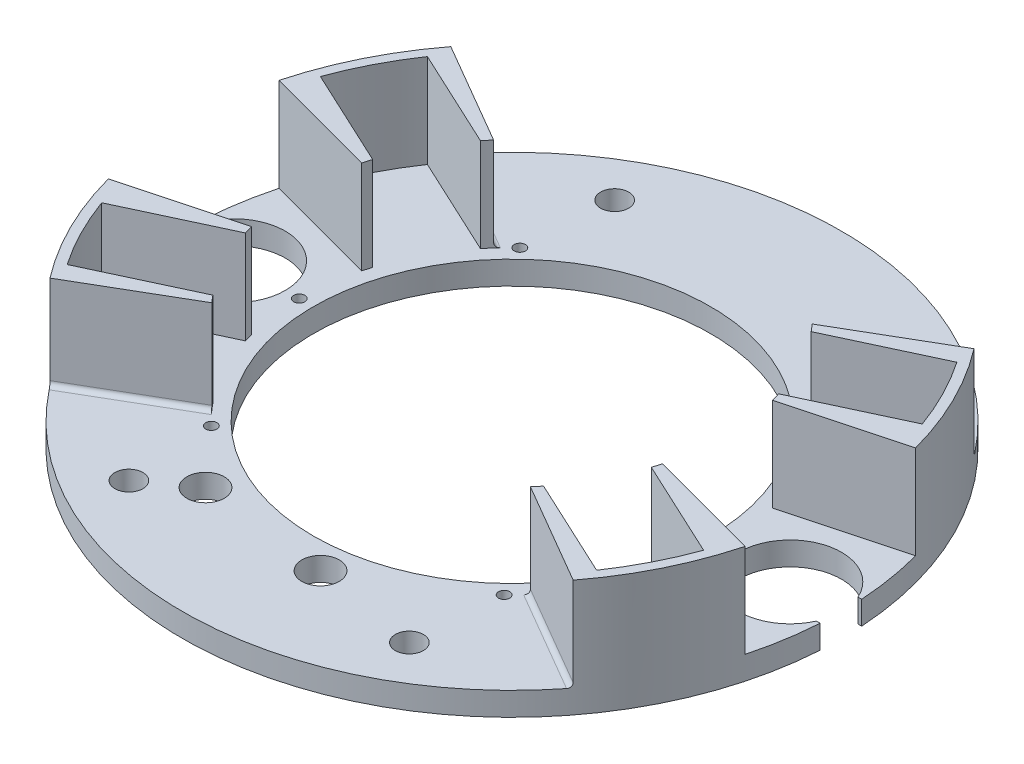
from build123d import *
from build123d.topology import SkipClean

# Parameters (mm, degrees)
SKETCH1_R                     = 89.535
SKETCH1_R_2                   = 53.975
BASE_DEPTH                    = 6.35
NOCE_START                    = -6.35
NOCE_CONE_PYROS_DEPTH         = 6.35
BATTERY_1_HOLDER_DEPTH        = 25.4
BATTERY_4_HOLDER_COPY_1_DEPTH = 25.4
BATTERY_4_HOLDER_COPY_2_DEPTH = 25.4
SKETCH4_R                     = 3.81
BOLT_HOLE_DEPTH               = 6.35
BOLT_HOLE_4_COPY_1_SKETCH_R   = 3.81
BOLT_HOLE_4_COPY_1_DEPTH      = 6.35
BOLT_HOLE_4_COPY_2_SKETCH_R   = 3.81
BOLT_HOLE_4_COPY_2_DEPTH      = 6.35
SKETCH11_R                    = 5.08
CUT_EXTRUDE2_DEPTH            = 6.35
SKETCH13_R                    = 3.175
CUT_EXTRUDE3_DEPTH            = 3.175
SKETCH14_R                    = 1.524
CUT_EXTRUDE4_DEPTH            = 3.175
FILLET3_R                     = 1.27
SKETCH15_R                    = 1.524
CUT_EXTRUDE5_DEPTH            = 6.35


with BuildPart() as part:
    # Sketch1 → Base (new body)
    with BuildSketch(Plane(origin=(0, 0, 0), x_dir=(1, 0, 0), z_dir=(0, 1, 0))):
        with Locations(Location((0, 0, 0), (0, 0, 270))):
            Circle(SKETCH1_R)
        with Locations(Location((0, 0, 0), (0, 0, 270))):
            Circle(SKETCH1_R_2, mode=Mode.SUBTRACT)
    extrude(amount=BASE_DEPTH)

    # Sketch2 → Noce Cone Pyros (cut)
    with BuildSketch(Plane(origin=(0, 6.35, 0), x_dir=(1, 0, 0), z_dir=(0, 1, 0)).offset(NOCE_START)):
        with BuildLine():
            Line((89.3564, 5.652439), (88.3404, 5.652439))
            ThreePointArc((88.3404, 5.652439), (61.595, 0), (88.3404, -5.652439))
            Line((88.3404, -5.652439), (89.3564, -5.652439))
            ThreePointArc((89.3564, -5.652439), (89.490339, -2.82763), (89.535, 0))
            ThreePointArc((89.535, 0), (89.490339, 2.82763), (89.3564, 5.652439))
        make_face()
    noce_cone_pyros = extrude(amount=NOCE_CONE_PYROS_DEPTH, mode=Mode.SUBTRACT)

    # Nose Cone Pyro mirror: Noce Cone Pyros across plane
    add(noce_cone_pyros.mirror(Plane(origin=(0, 0, 0), x_dir=(0, 0, 1), z_dir=(1, 0, 0))), mode=Mode.SUBTRACT)

    # Sketch3 → Battery 1 Holder (add)
    with BuildSketch(Plane(origin=(0, 6.35, 0), x_dir=(1, 0, 0), z_dir=(0, 1, 0))):
        with BuildLine():
            ThreePointArc((55.138033, 17.288828), (55.489291, 16.125907), (55.816024, 14.955859))
            Line((55.816024, 14.955859), (86.484169, 23.173363))
            ThreePointArc((86.484169, 23.173363), (80.316454, 39.569982), (71.074049, 54.451775))
            Line((71.074049, 54.451775), (43.281478, 38.286027))
            ThreePointArc((43.281478, 38.286027), (44.112475, 37.325538), (44.922161, 36.347018))
            Line((44.922161, 36.347018), (71.924647, 48.938484))
            ThreePointArc((71.924647, 48.938484), (77.444747, 39.628792), (81.766133, 29.705715))
            Line((81.766133, 29.705715), (55.138033, 17.288828))
        make_face()
    battery_1_holder = extrude(amount=BATTERY_1_HOLDER_DEPTH)

    # Batery 2 Holder: Battery 1 Holder across plane
    add(battery_1_holder.mirror(Plane.XY))

    # Battery 3 Holder: Battery 1 Holder across plane
    with SkipClean():  # the faces are left unmerged after this step: merging them gives an invalid solid
        add(battery_1_holder.mirror(Plane(origin=(0, 0, 0), x_dir=(0, 0, 1), z_dir=(1, 0, 0))))

    # Battery 4 Holder copy 1 sketch → Battery 4 Holder copy 1 (add)
    with SkipClean():  # the faces are left unmerged after this step: merging them gives an invalid solid
        with BuildSketch(Plane(origin=(0, 6.35, 0), x_dir=(-1, 0, 0), z_dir=(0, 1, 0))):
            with BuildLine():
                ThreePointArc((55.138033, 17.288828), (55.489291, 16.125907), (55.816024, 14.955859))
                Line((55.816024, 14.955859), (86.484169, 23.173363))
                ThreePointArc((86.484169, 23.173363), (80.316454, 39.569982), (71.074049, 54.451775))
                Line((71.074049, 54.451775), (43.281478, 38.286027))
                ThreePointArc((43.281478, 38.286027), (44.112475, 37.325538), (44.922161, 36.347018))
                Line((44.922161, 36.347018), (71.924647, 48.938484))
                ThreePointArc((71.924647, 48.938484), (77.444747, 39.628792), (81.766133, 29.705715))
                Line((81.766133, 29.705715), (55.138033, 17.288828))
            make_face()
        extrude(amount=BATTERY_4_HOLDER_COPY_1_DEPTH)

    # Battery 4 Holder copy 2 sketch → Battery 4 Holder copy 2 (add)
    with SkipClean():  # the faces are left unmerged after this step: merging them gives an invalid solid
        with BuildSketch(Plane(origin=(0, 6.35, 0), x_dir=(-1, 0, 0), z_dir=(0, 1, 0))):
            with BuildLine():
                ThreePointArc((55.138033, -17.288828), (55.489291, -16.125907), (55.816024, -14.955859))
                Line((55.816024, -14.955859), (86.484169, -23.173363))
                ThreePointArc((86.484169, -23.173363), (80.316454, -39.569982), (71.074049, -54.451775))
                Line((71.074049, -54.451775), (43.281478, -38.286027))
                ThreePointArc((43.281478, -38.286027), (44.112475, -37.325538), (44.922161, -36.347018))
                Line((44.922161, -36.347018), (71.924647, -48.938484))
                ThreePointArc((71.924647, -48.938484), (77.444747, -39.628792), (81.766133, -29.705715))
                Line((81.766133, -29.705715), (55.138033, -17.288828))
            make_face()
        extrude(amount=BATTERY_4_HOLDER_COPY_2_DEPTH)

    # Sketch4 → Bolt Hole (cut)
    with SkipClean():  # the faces are left unmerged after this step: merging them gives an invalid solid
        with BuildSketch(Plane(origin=(0, 6.35, 0), x_dir=(1, 0, 0), z_dir=(0, 1, 0))):
            with Locations(Location((38.1, 65.991136, 0), (0, 0, 270))):
                Circle(SKETCH4_R)
        bolt_hole = extrude(amount=-BOLT_HOLE_DEPTH, mode=Mode.SUBTRACT)

    # Bolt Hole 2: Bolt Hole across plane
    with SkipClean():  # the faces are left unmerged after this step: merging them gives an invalid solid
        add(bolt_hole.mirror(Plane.XY), mode=Mode.SUBTRACT)

    # Bolt Hole 3: Bolt Hole across plane
    with SkipClean():  # the faces are left unmerged after this step: merging them gives an invalid solid
        add(bolt_hole.mirror(Plane(origin=(0, 0, 0), x_dir=(0, 0, 1), z_dir=(1, 0, 0))), mode=Mode.SUBTRACT)

    # Bolt Hole 4 copy 1 sketch → Bolt Hole 4 copy 1 (cut)
    with SkipClean():  # the faces are left unmerged after this step: merging them gives an invalid solid
        with BuildSketch(Plane(origin=(0, 6.35, 0), x_dir=(-1, 0, 0), z_dir=(0, 1, 0))):
            with Locations(Location((38.1, 65.991136, 0), (0, 0, 270))):
                Circle(BOLT_HOLE_4_COPY_1_SKETCH_R)
        extrude(amount=-BOLT_HOLE_4_COPY_1_DEPTH, mode=Mode.SUBTRACT)

    # Bolt Hole 4 copy 2 sketch → Bolt Hole 4 copy 2 (cut)
    with SkipClean():  # the faces are left unmerged after this step: merging them gives an invalid solid
        with BuildSketch(Plane(origin=(0, 6.35, 0), x_dir=(-1, 0, 0), z_dir=(0, 1, 0))):
            with Locations((38.1, -65.991136)):
                Circle(BOLT_HOLE_4_COPY_2_SKETCH_R)
        extrude(amount=-BOLT_HOLE_4_COPY_2_DEPTH, mode=Mode.SUBTRACT)

    # Sketch11 → Cut-Extrude2 (cut)
    with SkipClean():  # the faces are left unmerged after this step: merging them gives an invalid solid
        with BuildSketch(Plane.XZ):
            with Locations(Location((9.128366, 61.145977, 0), (0, 0, 270))):
                Circle(SKETCH11_R)
            with Locations(Location((-26.059706, 57.209264, 0), (0, 0, 270))):
                Circle(SKETCH11_R)
        extrude(amount=-CUT_EXTRUDE2_DEPTH, mode=Mode.SUBTRACT)

    # Sketch13 → Cut-Extrude3 (cut)
    with SkipClean():  # the faces are left unmerged after this step: merging them gives an invalid solid
        with BuildSketch(Plane.XZ):
            with Locations(Location((39.7764, 41.91, 0), (0, 0, 270))):
                Circle(SKETCH13_R)
            with Locations(Location((-39.7764, 41.91, 0), (0, 0, 270))):
                Circle(SKETCH13_R)
        cut_extrude3 = extrude(amount=-CUT_EXTRUDE3_DEPTH, mode=Mode.SUBTRACT)

    # Sketch14 → Cut-Extrude4 (cut)
    with SkipClean():  # the faces are left unmerged after this step: merging them gives an invalid solid
        with BuildSketch(Plane.XZ.offset(-3.175)):
            with Locations(Location((39.7764, 41.91, 0), (0, 0, 270))):
                Circle(SKETCH14_R)
            with Locations(Location((-39.7764, 41.91, 0), (0, 0, 270))):
                Circle(SKETCH14_R)
        cut_extrude4 = extrude(amount=-CUT_EXTRUDE4_DEPTH, mode=Mode.SUBTRACT)

    # Mirror1: Cut-Extrude3, Cut-Extrude4 across plane
    with SkipClean():  # the faces are left unmerged after this step: merging them gives an invalid solid
        add(cut_extrude3.mirror(Plane.XY), mode=Mode.SUBTRACT)
        add(cut_extrude4.mirror(Plane.XY), mode=Mode.SUBTRACT)

    # Fillet3
    # the kernel refuses this fillet: 1.27 mm, written as the material it adds along each edge
    with BuildSketch(Plane(origin=(-73.818547, 6.35, 56.048132), x_dir=(0.5027895932474892, 0, 0.8644088297339543), z_dir=(0.8644088297339544, 0, -0.5027895932474892))) as fillet3_piece_1_section:
        with BuildLine():
            CenterArc((FILLET3_R, -FILLET3_R), FILLET3_R, 90, 90)
            Line((0, -FILLET3_R), (0, 0))
            Line((0, 0), (FILLET3_R, 0))
        make_face()
    fillet3_piece_1 = extrude(amount=38.502113, mode=Mode.PRIVATE)
    fillet3_piece_1 = fillet3_piece_1 & Plane(origin=(0, 6.637419, 0), x_dir=(0, 0, 1), z_dir=(0, -1, 0)) * Cylinder(89.535, 83, mode=Mode.PRIVATE)
    fillet3_piece_1 = fillet3_piece_1 - Plane(origin=(0, 6.637419, 0), x_dir=(-0.7490088761778874, 0, 0.6625599621217225), z_dir=(0, -1, 0)) * Cylinder(57.785, 83, mode=Mode.PRIVATE)
    add(fillet3_piece_1)
    with BuildSketch(Plane(origin=(73.818547, 6.35, -56.048132), x_dir=(-0.5027895932474892, 0, -0.8644088297339543), z_dir=(-0.8644088297339544, 0, 0.5027895932474892))) as fillet3_piece_2_section:
        with BuildLine():
            CenterArc((FILLET3_R, -FILLET3_R), FILLET3_R, 90, 90)
            Line((0, -FILLET3_R), (0, 0))
            Line((0, 0), (FILLET3_R, 0))
        make_face()
    fillet3_piece_2 = extrude(amount=38.502113, mode=Mode.PRIVATE)
    fillet3_piece_2 = fillet3_piece_2 - Plane(origin=(0, 6.637419, 0), x_dir=(0.7490088761778874, 0, -0.6625599621217225), z_dir=(0, -1, 0)) * Cylinder(57.785, 83, mode=Mode.PRIVATE)
    fillet3_piece_2 = fillet3_piece_2 & Plane(origin=(0, 6.637419, 0), x_dir=(0, 0, 1), z_dir=(0, -1, 0)) * Cylinder(89.535, 83, mode=Mode.PRIVATE)
    add(fillet3_piece_2)
    with BuildSketch(Plane(origin=(73.818547, 6.35, 56.048132), x_dir=(-0.5027895932474892, 0, 0.8644088297339543), z_dir=(-0.8644088297339544, 0, -0.5027895932474892))) as fillet3_piece_3_section:
        with BuildLine():
            CenterArc((FILLET3_R, FILLET3_R), FILLET3_R, 180, 90)
            Line((0, FILLET3_R), (0, 0))
            Line((0, 0), (FILLET3_R, 0))
        make_face()
    fillet3_piece_3 = extrude(amount=38.502113, mode=Mode.PRIVATE)
    fillet3_piece_3 = fillet3_piece_3 & Plane(origin=(0, 6.637418, 0), x_dir=(0, 0, 1), z_dir=(0, -1, 0)) * Cylinder(89.535, 83, mode=Mode.PRIVATE)
    fillet3_piece_3 = fillet3_piece_3 - Plane(origin=(0, 6.637418, 0), x_dir=(0.7490088761778874, 0, 0.6625599621217225), z_dir=(0, -1, 0)) * Cylinder(57.785, 83, mode=Mode.PRIVATE)
    add(fillet3_piece_3)
    with BuildSketch(Plane(origin=(-73.818547, 6.35, -56.048132), x_dir=(0.5027895932474892, 0, -0.8644088297339543), z_dir=(0.8644088297339544, 0, 0.5027895932474892))) as fillet3_piece_4_section:
        with BuildLine():
            CenterArc((FILLET3_R, FILLET3_R), FILLET3_R, 180, 90)
            Line((0, FILLET3_R), (0, 0))
            Line((0, 0), (FILLET3_R, 0))
        make_face()
    fillet3_piece_4 = extrude(amount=38.502113, mode=Mode.PRIVATE)
    fillet3_piece_4 = fillet3_piece_4 & Plane(origin=(0, 6.637418, 0), x_dir=(0, 0, 1), z_dir=(0, -1, 0)) * Cylinder(89.535, 83, mode=Mode.PRIVATE)
    fillet3_piece_4 = fillet3_piece_4 - Plane(origin=(0, 6.637418, 0), x_dir=(-0.7490088761778874, 0, -0.6625599621217225), z_dir=(0, -1, 0)) * Cylinder(57.785, 83, mode=Mode.PRIVATE)
    add(fillet3_piece_4)

    # Sketch15 → Cut-Extrude5 (cut)
    with BuildSketch(Plane.XZ):
        with Locations(Location((57.785, 0, 0), (0, 0, 270))):
            Circle(SKETCH15_R)
    cut_extrude5 = extrude(amount=-CUT_EXTRUDE5_DEPTH, mode=Mode.SUBTRACT)

    # Mirror2: Cut-Extrude5 across plane
    add(cut_extrude5.mirror(Plane(origin=(0, 0, 0), x_dir=(0, 0, 1), z_dir=(1, 0, 0))), mode=Mode.SUBTRACT)


solid = part.part
